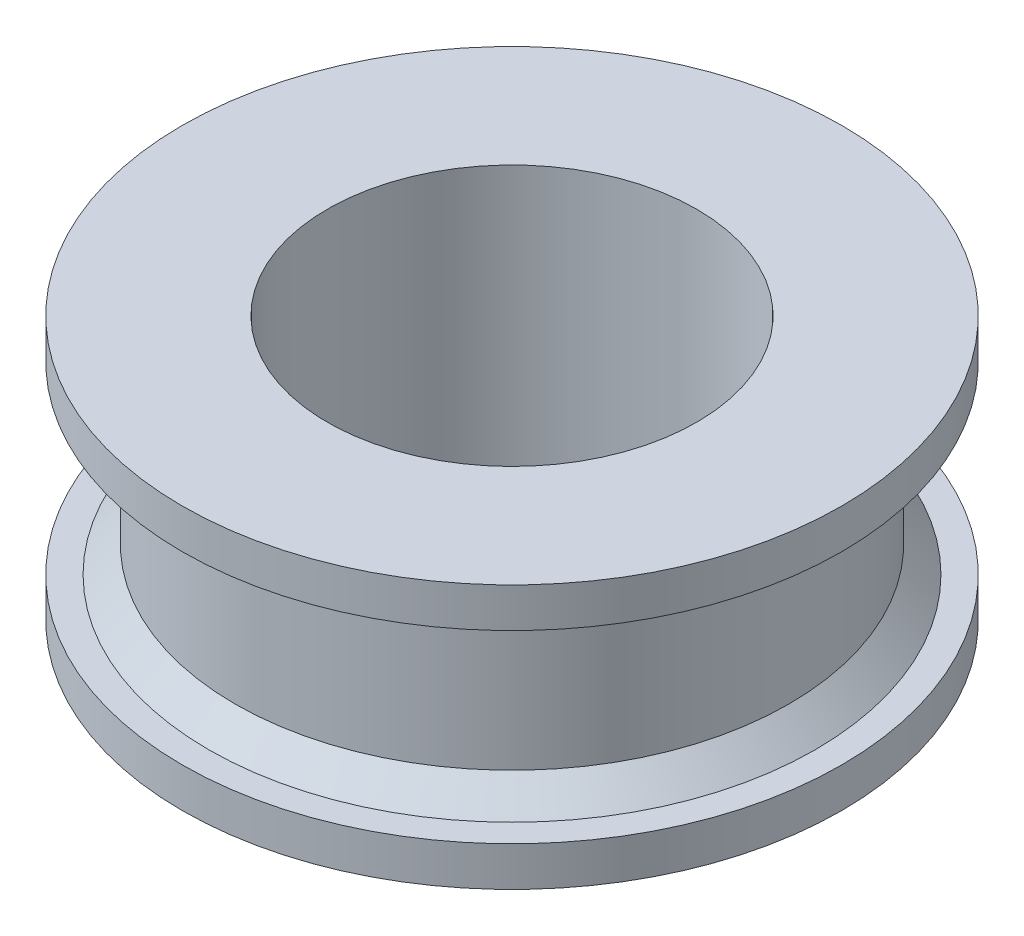
from build123d import *


with BuildPart() as part:
    # Sketch1 → Revolve1 (revolve)
    with BuildSketch(Plane.XY):
        Polygon((7, -5), (7, 5), (12.5, 5), (12.5, 3.5), (11.5, 3.5), (10.5, 2.5), (10.5, -2.5), (11.5, -3.5), (12.5, -3.5), (12.5, -5), align=None)
    revolve(axis=Axis((0, -14.844827586, 0), (0, 1, 0)))


solid = part.part
